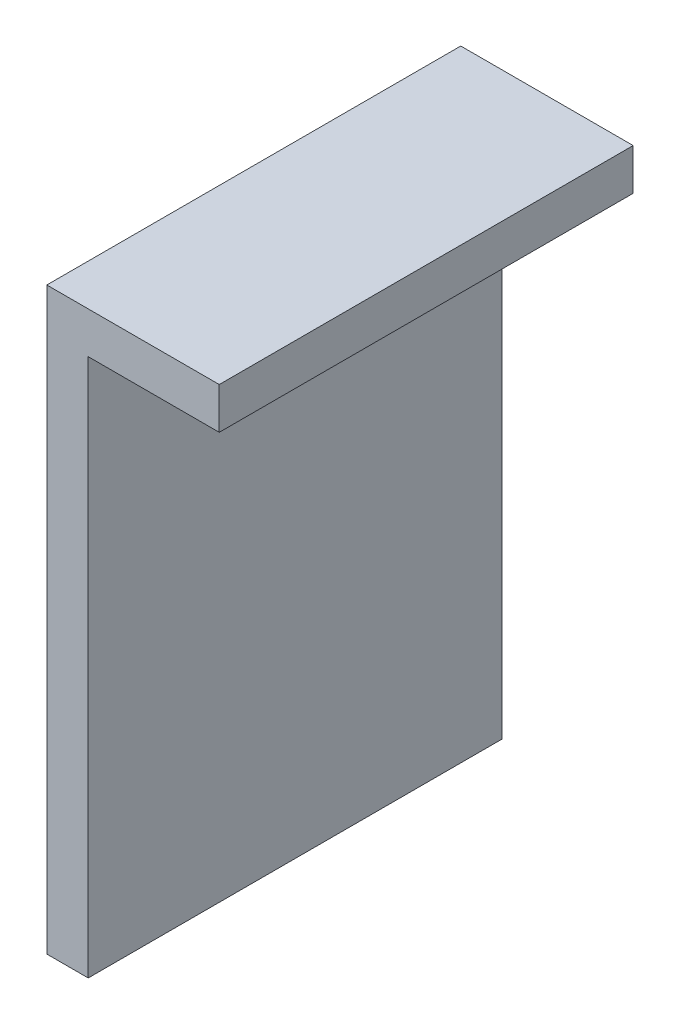
from build123d import *

# Parameters (mm, degrees)
BOSS_EXTRUDE1_DEPTH = 15


with BuildPart() as part:
    # Sketch1 → Boss-Extrude1 (new, symmetric)
    with BuildSketch(Plane.XY):
        Polygon((0, 0), (0, 42), (12.496402878, 42), (12.496402878, 39), (3, 39), (3, 0), align=None)
    extrude(amount=BOSS_EXTRUDE1_DEPTH, both=True)


solid = part.part
